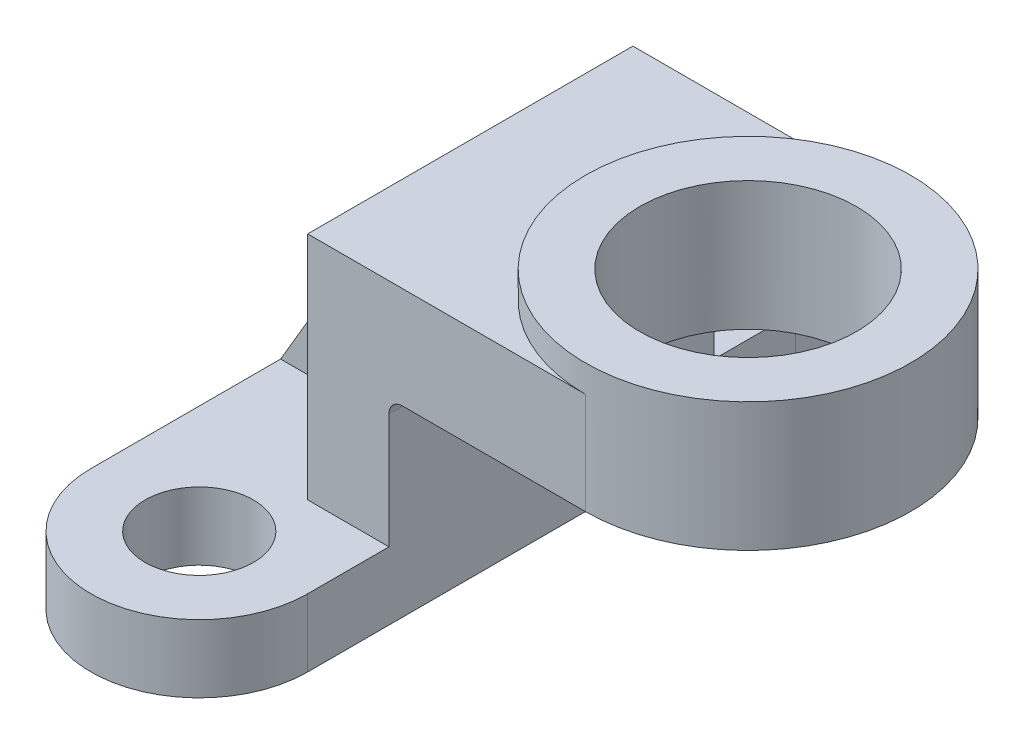
from build123d import *

# Parameters (mm, degrees)
SKETCH2_R                = 8
BOSS_EXTRUDE1_DEPTH      = 10
BOSS_EXTRUDE2_DEPTH      = 24
BOSS_EXTRUDE2_DEPTH_BACK = 24
BOSS_EXTRUDE3_DEPTH      = 4
BOSS_EXTRUDE3_DEPTH_BACK = 15
SKETCH4_R                = 24
CUT_EXTRUDE1_DEPTH       = 10
CUT_EXTRUDE1_DEPTH_BACK  = 25
SKETCH5_R                = 16
RIB8_REACH               = 100.838
SKETCH8_WALL_W           = 239.122669256
SKETCH8_WALL_H           = 16


with BuildPart() as part:
    # Sketch2 → Boss-Extrude1 (new body)
    with BuildSketch(Plane(origin=(0, 0, 0), x_dir=(1, 0, 0), z_dir=(0, 1, 0))):
        with BuildLine():
            ThreePointArc((16, 36), (0, 52), (-16, 36))
            Line((-16, 36), (-16, -36))
            ThreePointArc((-16, -36), (0, -52), (16, -36))
            Line((16, -36), (16, 36))
        make_face()
        with Locations((0, 36)):
            Circle(SKETCH2_R, mode=Mode.SUBTRACT)
        with Locations((0, -36)):
            Circle(SKETCH2_R, mode=Mode.SUBTRACT)
    extrude(amount=BOSS_EXTRUDE1_DEPTH)

    # Sketch3 → Boss-Extrude2 (add, two sides: drawn at the far end of the back side and taken through both)
    with BuildSketch(Plane.XY.offset(-BOSS_EXTRUDE2_DEPTH_BACK)):
        with BuildLine():
            Line((16, 10), (16, 27))
            ThreePointArc((16, 27), (16.585786438, 28.414213562), (18, 29))
            Line((18, 29), (45, 29))
            Line((45, 29), (45, 44))
            Line((45, 44), (4, 44))
            Line((4, 44), (4, 10))
            Line((4, 10), (16, 10))
        make_face()
    extrude(amount=BOSS_EXTRUDE2_DEPTH + BOSS_EXTRUDE2_DEPTH_BACK)

    # Sketch4 → Boss-Extrude3 (add, two sides: drawn at the far end of the back side and taken through both)
    with BuildSketch(Plane(origin=(0, 44, 0), x_dir=(1, 0, 0), z_dir=(0, 1, 0)).offset(-BOSS_EXTRUDE3_DEPTH_BACK)):
        with Locations((45, 0)):
            Circle(SKETCH4_R)
    extrude(amount=BOSS_EXTRUDE3_DEPTH + BOSS_EXTRUDE3_DEPTH_BACK)

    # Sketch5 → Cut-Extrude1 (cut, two sides: drawn at the far end of the back side and taken through both)
    with BuildSketch(Plane(origin=(0, 48, 0), x_dir=(1, 0, 0), z_dir=(0, 1, 0)).offset(-CUT_EXTRUDE1_DEPTH_BACK)):
        with Locations((45, 0)):
            Circle(SKETCH5_R)
    extrude(amount=CUT_EXTRUDE1_DEPTH + CUT_EXTRUDE1_DEPTH_BACK, mode=Mode.SUBTRACT)

    # Sketch8 wall → Rib8 (add, up to next)
    with BuildSketch(Plane(origin=(-6, 27, 0), x_dir=(-0.507020126563, -0.861934215158, 0), z_dir=(0.861934215158, -0.507020126563, 0)), mode=Mode.PRIVATE) as rib8_sk1:
        Rectangle(SKETCH8_WALL_W, SKETCH8_WALL_H)
    rib8_tool1 = extrude(rib8_sk1.sketch, amount=RIB8_REACH, mode=Mode.PRIVATE) - part.part
    add(rib8_tool1.solids().sort_by_distance((-6, 27, 0))[0])


solid = part.part
